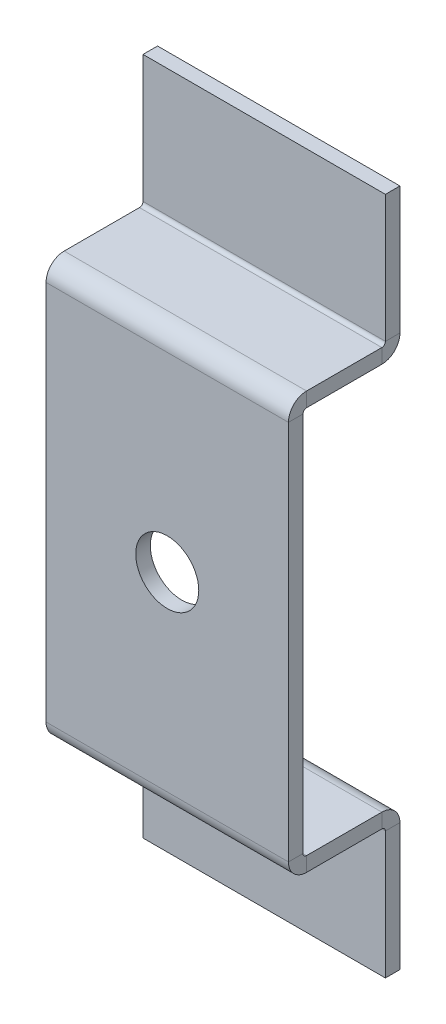
from build123d import *

# Parameters (mm, degrees)
SKETCH_1_W                         = 50
SKETCH_1_H                         = 80
SM_BASE_FLANGE_1_DEPTH             = 3
SM_EDGE_FLANGE_1_STRIP_W           = 13.4732
SM_EDGE_FLANGE_1_STRIP_H           = 3
SM_EDGE_FLANGE_1_STRIP_CUT_DEPTH   = 50
SM_EDGE_FLANGE_1_STRIP_2_W         = 13.4732
SM_EDGE_FLANGE_1_STRIP_2_H         = 3
SM_EDGE_FLANGE_1_STRIP_CUT_2_DEPTH = 50
SM_EDGE_FLANGE_1_DEPTH             = 50
SM_EDGE_FLANGE_1_BEND_DEPTH        = 50
SM_EDGE_FLANGE_2_STRIP_W           = 13.4732
SM_EDGE_FLANGE_2_STRIP_H           = 3
SM_EDGE_FLANGE_2_STRIP_CUT_DEPTH   = 50
SM_EDGE_FLANGE_2_STRIP_2_W         = 13.4732
SM_EDGE_FLANGE_2_STRIP_2_H         = 3
SM_EDGE_FLANGE_2_STRIP_CUT_2_DEPTH = 50
SM_EDGE_FLANGE_2_DEPTH             = 50
SM_EDGE_FLANGE_2_BEND_DEPTH        = 50
SKETCH_18_R                        = 6.5
CUT_EXTRUDE_1_DEPTH                = 124


# Sheet-metal steps are written as plain solids
with BuildPart() as part:
    # Sketch 1 → 基体-法兰1 (new body)
    with BuildSketch(Plane.XY):
        with Locations((25, 40)):
            Rectangle(SKETCH_1_W, SKETCH_1_H)
    extrude(amount=-SM_BASE_FLANGE_1_DEPTH)

    # 边线-法兰1 strip (across the edge) → 边线-法兰1 strip cut (cut)
    with BuildSketch(Plane(origin=(0, 80, -3), x_dir=(0, -1, 0), z_dir=(1, 0, 0))):
        with Locations((-6, -1.5)):
            Rectangle(SM_EDGE_FLANGE_1_STRIP_W, SM_EDGE_FLANGE_1_STRIP_H)
    extrude(amount=SM_EDGE_FLANGE_1_STRIP_CUT_DEPTH, mode=Mode.SUBTRACT)

    # 边线-法兰1 strip 2 (across the edge) → 边线-法兰1 strip cut 2 (cut)
    with BuildSketch(Plane(origin=(50, 0, -3), x_dir=(0, 1, 0), z_dir=(-1, 0, 0))):
        with Locations((-6, -1.5)):
            Rectangle(SM_EDGE_FLANGE_1_STRIP_2_W, SM_EDGE_FLANGE_1_STRIP_2_H)
    extrude(amount=SM_EDGE_FLANGE_1_STRIP_CUT_2_DEPTH, mode=Mode.SUBTRACT)

    # 边线-法兰1 section (across the edge) → 边线-法兰1 (add)
    with BuildSketch(Plane(origin=(0, 80, -3), x_dir=(0, -1, 0), z_dir=(1, 0, 0))):
        with BuildLine():
            Line((-3, 0.7366), (-3, 17))
            Line((-3, 17), (0, 17))
            Line((0, 17), (0, 0.7366))
            ThreePointArc((0, 0.7366), (0.215745145, 0.215745145), (0.7366, 0))
            Line((0.7366, 0), (0.7366, -3))
            ThreePointArc((0.7366, -3), (-1.905575199, -1.905575199), (-3, 0.7366))
        make_face()
    extrude(amount=SM_EDGE_FLANGE_1_DEPTH)

    # 边线-法兰1 section 2 (across the edge) → 边线-法兰1 bend (add)
    with BuildSketch(Plane(origin=(50, 0, -3), x_dir=(0, 1, 0), z_dir=(-1, 0, 0))):
        with BuildLine():
            Line((-3, 0.7366), (-3, 17))
            Line((-3, 17), (0, 17))
            Line((0, 17), (0, 0.7366))
            ThreePointArc((0, 0.7366), (0.215745145, 0.215745145), (0.7366, 0))
            Line((0.7366, 0), (0.7366, -3))
            ThreePointArc((0.7366, -3), (-1.905575199, -1.905575199), (-3, 0.7366))
        make_face()
    extrude(amount=SM_EDGE_FLANGE_1_BEND_DEPTH)

    # 边线-法兰2 strip (across the edge) → 边线-法兰2 strip cut (cut)
    with BuildSketch(Plane(origin=(0, -3, -20), x_dir=(0, 0, 1), z_dir=(1, 0, 0))):
        with Locations((-6, -1.5)):
            Rectangle(SM_EDGE_FLANGE_2_STRIP_W, SM_EDGE_FLANGE_2_STRIP_H)
    extrude(amount=SM_EDGE_FLANGE_2_STRIP_CUT_DEPTH, mode=Mode.SUBTRACT)

    # 边线-法兰2 strip 2 (across the edge) → 边线-法兰2 strip cut 2 (cut)
    with BuildSketch(Plane(origin=(50, 83, -20), x_dir=(0, 0, 1), z_dir=(-1, 0, 0))):
        with Locations((-6, -1.5)):
            Rectangle(SM_EDGE_FLANGE_2_STRIP_2_W, SM_EDGE_FLANGE_2_STRIP_2_H)
    extrude(amount=SM_EDGE_FLANGE_2_STRIP_CUT_2_DEPTH, mode=Mode.SUBTRACT)

    # 边线-法兰2 section (across the edge) → 边线-法兰2 (add)
    with BuildSketch(Plane(origin=(0, -3, -20), x_dir=(0, 0, 1), z_dir=(1, 0, 0))):
        with BuildLine():
            Line((-3, 0.7366), (-3, 27))
            Line((-3, 27), (0, 27))
            Line((0, 27), (0, 0.7366))
            ThreePointArc((0, 0.7366), (0.215745145, 0.215745145), (0.7366, 0))
            Line((0.7366, 0), (0.7366, -3))
            ThreePointArc((0.7366, -3), (-1.905575199, -1.905575199), (-3, 0.7366))
        make_face()
    extrude(amount=SM_EDGE_FLANGE_2_DEPTH)

    # 边线-法兰2 section 2 (across the edge) → 边线-法兰2 bend (add)
    with BuildSketch(Plane(origin=(50, 83, -20), x_dir=(0, 0, 1), z_dir=(-1, 0, 0))):
        with BuildLine():
            Line((-3, 0.7366), (-3, 27))
            Line((-3, 27), (0, 27))
            Line((0, 27), (0, 0.7366))
            ThreePointArc((0, 0.7366), (0.215745145, 0.215745145), (0.7366, 0))
            Line((0.7366, 0), (0.7366, -3))
            ThreePointArc((0.7366, -3), (-1.905575199, -1.905575199), (-3, 0.7366))
        make_face()
    extrude(amount=SM_EDGE_FLANGE_2_BEND_DEPTH)

    # 草图18 → 切除-拉伸1 (cut, through all)
    with BuildSketch(Plane.XY):
        with Locations((25, 40)):
            Circle(SKETCH_18_R)
    extrude(amount=-CUT_EXTRUDE_1_DEPTH, mode=Mode.SUBTRACT)


solid = part.part
